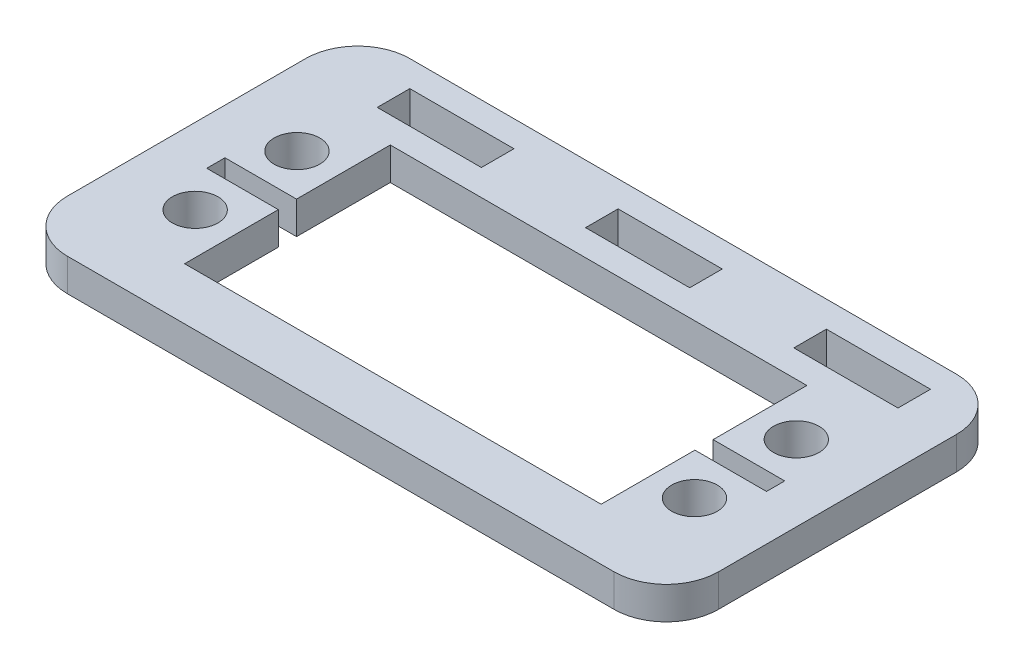
from build123d import *

# Parameters (mm, degrees)
SKETCH1_W            = 63.5
SKETCH1_H            = 33.401
SKETCH1_W_2          = 10.16
SKETCH1_H_2          = 3.175
SKETCH1_W_3          = 40.64
SKETCH1_H_3          = 20.066
MAIN_EXTRUSION_DEPTH = 3.175
SKETCH3_R            = 2.2225
MOUNTING_HOLES_DEPTH = 37.777630008
TAB_CUTOUT_DEPTH     = 37.777630008
FILLET1_R            = 5.08


with BuildPart() as part:
    # Sketch1 → Main Extrusion (new body)
    with BuildSketch(Plane(origin=(0, 0, 0), x_dir=(1, 0, 0), z_dir=(0, 1, 0))):
        with Locations((0, 1.5875)):
            Rectangle(SKETCH1_W, SKETCH1_H)
        with Locations((21.59, 14.1605)):
            Rectangle(SKETCH1_W_2, SKETCH1_H_2, mode=Mode.SUBTRACT)
        with Locations((1.27, 14.1605)):
            Rectangle(SKETCH1_W_2, SKETCH1_H_2, mode=Mode.SUBTRACT)
        with Locations((-19.05, 14.1605)):
            Rectangle(SKETCH1_W_2, SKETCH1_H_2, mode=Mode.SUBTRACT)
        Rectangle(SKETCH1_W_3, SKETCH1_H_3, mode=Mode.SUBTRACT)
    extrude(amount=MAIN_EXTRUSION_DEPTH)

    # Sketch3 → Mounting Holes (cut, through all)
    with BuildSketch(Plane(origin=(0, 3.175, 0), x_dir=(1, 0, 0), z_dir=(0, 1, 0))):
        with Locations((-24.357246486, 4.9657)):
            Circle(SKETCH3_R)
        with Locations((-24.357246486, -4.9657)):
            Circle(SKETCH3_R)
        with Locations((24.357246486, -4.9657)):
            Circle(SKETCH3_R)
        with Locations((24.357246486, 4.9657)):
            Circle(SKETCH3_R)
    extrude(amount=-MOUNTING_HOLES_DEPTH, mode=Mode.SUBTRACT)

    # Sketch5 → Tab cutout (cut, through all)
    with BuildSketch(Plane(origin=(0, 3.175, 0), x_dir=(1, 0, 0), z_dir=(0, 1, 0))):
        Polygon((-20.32, 0), (-20.32, 0.889), (-27.305, 0.889), (-27.305, -0.889), (-20.32, -0.889), align=None)
        Polygon((27.305, -0.889), (20.32, -0.889), (20.32, 0), (20.32, 0.889), (27.305, 0.889), align=None)
    extrude(amount=-TAB_CUTOUT_DEPTH, mode=Mode.SUBTRACT)

    # Fillet1
    fillet1_edges = [part.edges().sort_by_distance(p)[0] for p in [
        (31.75, 1.5875, -18.288),
        (31.75, 1.5875, 15.113),
        (-31.75, 1.5875, 15.113),
        (-31.75, 1.5875, -18.288),
    ]]
    fillet(fillet1_edges, radius=FILLET1_R)


solid = part.part
